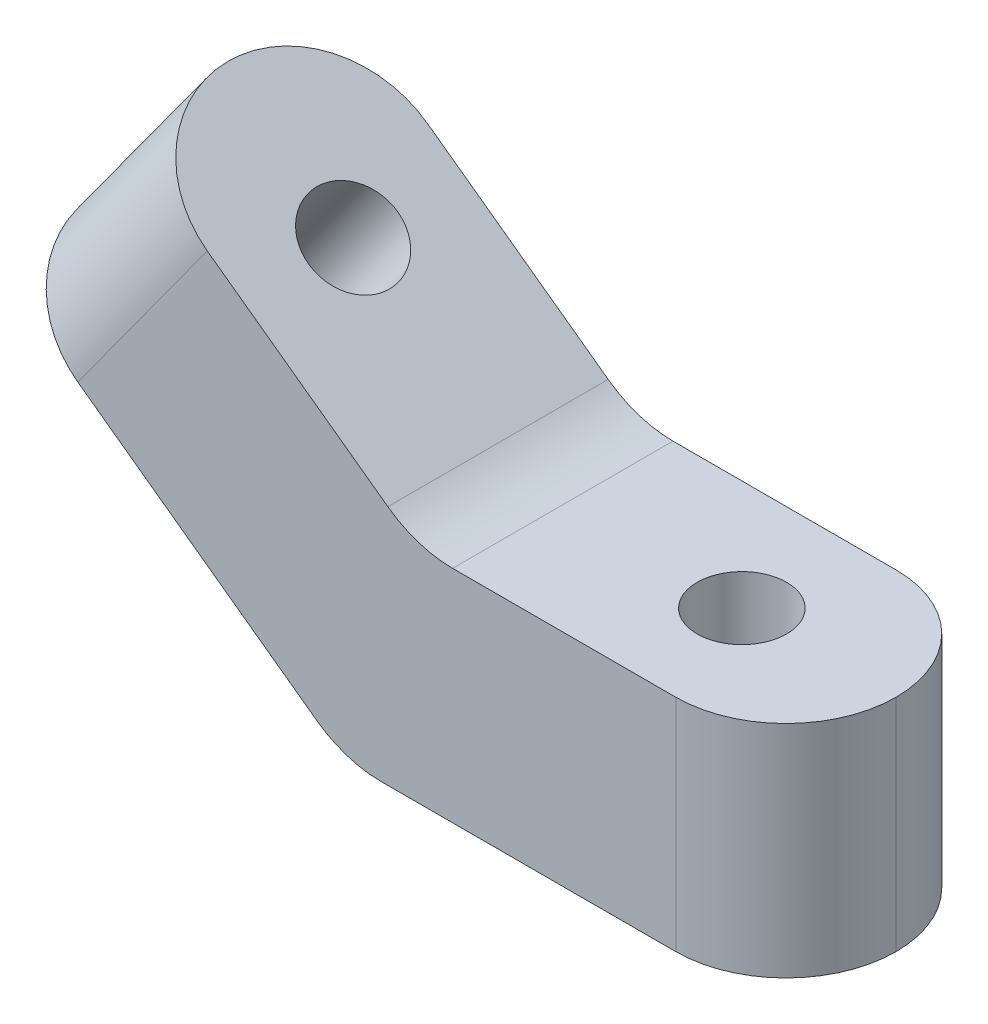
from build123d import *

# Parameters (mm, degrees)
BOSS_EXTRUDE1_DEPTH = 12.7
SKETCH2_R           = 2.5796875
CUT_EXTRUDE1_DEPTH  = 26.162
SKETCH3_R           = 2.5796875
CUT_EXTRUDE2_DEPTH  = 26.162
FILLET1_R           = 6.35
FILLET2_R           = 6.35


with BuildPart() as part:
    # Sketch1 → Boss-Extrude1 (new body)
    with BuildSketch(Plane.XY):
        Polygon((27.808756526, 8.005672944), (6.535236668, 8.005672944), (-10.675402427, 20.509934181), (-18.140275131, 10.235418352), (2.408756526, -4.694327056), (27.808756526, -4.694327056), align=None)
    extrude(amount=BOSS_EXTRUDE1_DEPTH)

    # Sketch2 → Cut-Extrude1 (cut)
    with BuildSketch(Plane(origin=(0, 8.005672944, 0), x_dir=(1, 0, 0), z_dir=(0, 1, 0))):
        with Locations(Location((18.918756526, -6.35, 0), (0, 0, 180))):
            Circle(SKETCH2_R)
    extrude(amount=-CUT_EXTRUDE1_DEPTH, mode=Mode.SUBTRACT)

    # Sketch3 → Cut-Extrude2 (cut)
    with BuildSketch(Plane(origin=(6.064792448, 8.347470677, 0), x_dir=(0.809016994374947, -0.5877852522924737, 0), z_dir=(0.5877852522924737, 0.809016994374947, 0))):
        with Locations(Location((-11.802018822, -6.35, 0), (0, 0, 180))):
            Circle(SKETCH3_R)
    extrude(amount=-CUT_EXTRUDE2_DEPTH, mode=Mode.SUBTRACT)

    # Fillet1
    fillet1_edges = [part.edges().sort_by_distance(p)[0] for p in [
        (-14.407838779, 15.372676266, 0),
        (-14.407838779, 15.372676266, 12.7),
        (27.808756526, 1.655672944, 0),
        (27.808756526, 1.655672944, 12.7),
    ]]
    fillet(fillet1_edges, radius=FILLET1_R - 0.0001)  # a hair under: the kernel refuses the full size

    # Fillet2
    fillet2_edges = [part.edges().sort_by_distance(p)[0] for p in [
        (2.408756526, -4.694327056, 6.35),
        (6.535236668, 8.005672944, 6.35),
    ]]
    fillet(fillet2_edges, radius=FILLET2_R)


solid = part.part
